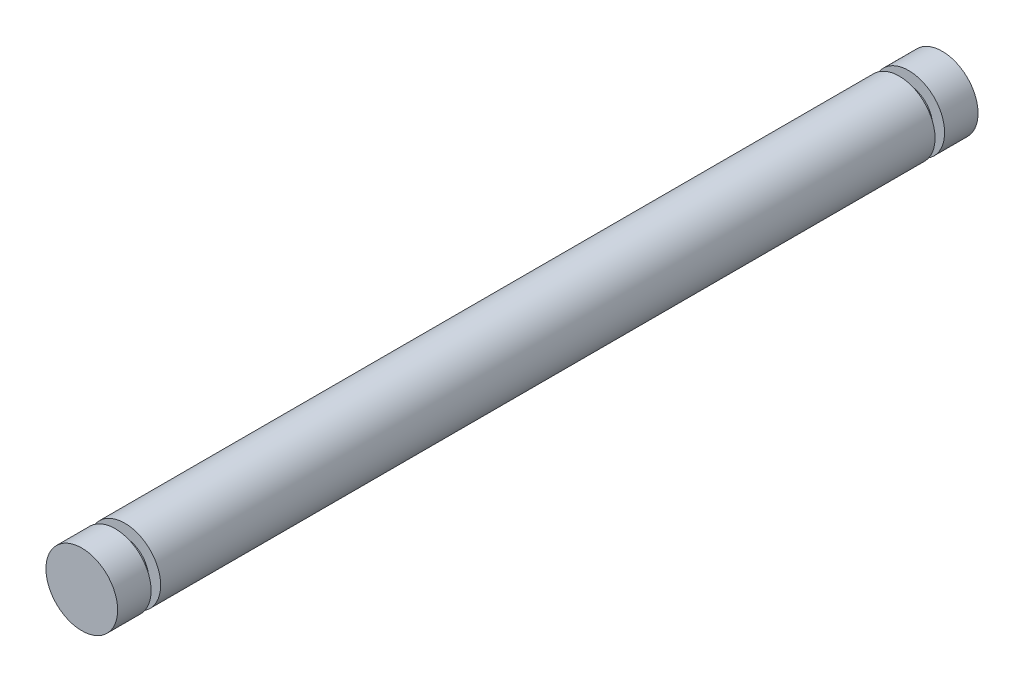
from build123d import *

# Parameters (mm, degrees)
SKETCH1_R           = 4.7625
BOSS_EXTRUDE1_DEPTH = 102.87
SKETCH2_R           = 3.175
BOSS_EXTRUDE2_DEPTH = 1.27
BOSS_EXTRUDE3_START = 4.445
SKETCH3_R           = 4.7625
BOSS_EXTRUDE3_DEPTH = 4.445
BOSS_EXTRUDE4_START = 1.27
SKETCH4_R           = 3.175
BOSS_EXTRUDE4_DEPTH = 1.27
SKETCH5_R           = 4.7625
BOSS_EXTRUDE5_DEPTH = 4.445


with BuildPart() as part:
    # Sketch1 → Boss-Extrude1 (new body)
    with BuildSketch(Plane.XY):
        Circle(SKETCH1_R)
    extrude(amount=BOSS_EXTRUDE1_DEPTH)

    # Sketch2 → Boss-Extrude2 (add)
    with BuildSketch(Plane(origin=(0, 0, 0), x_dir=(-1, 0, 0), z_dir=(0, 0, -1))):
        Circle(SKETCH2_R)
    extrude(amount=BOSS_EXTRUDE2_DEPTH)

    # Sketch3 → Boss-Extrude3 (add)
    with BuildSketch(Plane(origin=(0, 0, -1.27), x_dir=(-1, 0, 0), z_dir=(0, 0, -1)).offset(BOSS_EXTRUDE3_START)):
        Circle(SKETCH3_R)
    extrude(amount=-BOSS_EXTRUDE3_DEPTH)

    # Sketch4 → Boss-Extrude4 (add)
    with BuildSketch(Plane.XY.offset(102.87).offset(BOSS_EXTRUDE4_START)):
        Circle(SKETCH4_R)
    extrude(amount=-BOSS_EXTRUDE4_DEPTH)

    # Sketch5 → Boss-Extrude5 (add)
    with BuildSketch(Plane.XY.offset(104.14)):
        Circle(SKETCH5_R)
    extrude(amount=BOSS_EXTRUDE5_DEPTH)


solid = part.part
